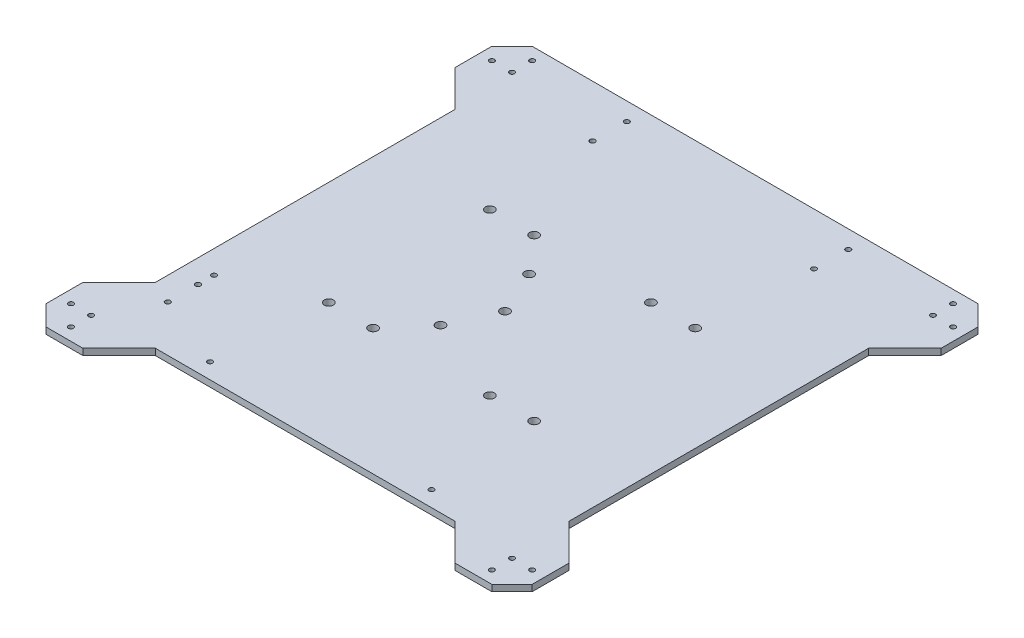
from build123d import *

# Parameters (mm, degrees)
BOSS_EXTRUDE1_DEPTH      = 3.175
SKETCH2_R                = 1.5
SKETCH2_R_2              = 2.25
CUT_EXTRUDE1_DEPTH       = 171.795800958
M3X0_5_TAPPED_HOLE1_D    = 2.5
SKETCH5_R                = 1.25
CUT_EXTRUDE2_DEPTH       = 171.795800958
SKETCH6_R                = 1.25
CUT_EXTRUDE3_DEPTH       = 10
M4_CLEARANCE_HOLE1_D     = 4.5
M4_CLEARANCE_HOLE1_DEPTH = 10
M4_CLEARANCE_HOLE1_TIP   = 1.351936393
CUT_EXTRUDE4_DEPTH       = 10
M3X0_5_TAPPED_HOLE2_D    = 2.5


with BuildPart() as part:
    # Sketch1 → Boss-Extrude1 (new body)
    with BuildSketch(Plane(origin=(0, 0, 0), x_dir=(1, 0, 0), z_dir=(0, 1, 0))):
        Polygon((-110.75, 120.75), (110.75, 120.75), (120.75, 110.75), (120.75, -110.75), (110.75, -120.75), (-110.75, -120.75), (-120.75, -110.75), (-120.75, 110.75), align=None)
    extrude(amount=BOSS_EXTRUDE1_DEPTH)

    # Sketch2 → Cut-Extrude1 (cut, through all)
    with BuildSketch(Plane(origin=(0, 3.175, 0), x_dir=(1, 0, 0), z_dir=(0, 1, 0))):
        with Locations((-51, -40)):
            Circle(SKETCH2_R)
        with Locations((-29, -40)):
            Circle(SKETCH2_R_2)
        with Locations((-51, 40)):
            Circle(SKETCH2_R)
        with Locations((-29, 40)):
            Circle(SKETCH2_R_2)
        with Locations((29, 40)):
            Circle(SKETCH2_R_2)
        with Locations((51, 40)):
            Circle(SKETCH2_R_2)
        with Locations((29, -40)):
            Circle(SKETCH2_R_2)
        with Locations((51, -40)):
            Circle(SKETCH2_R_2)
        with Locations((-3.5, 0)):
            Circle(SKETCH2_R_2)
        with Locations((-13.5, 22)):
            Circle(SKETCH2_R_2)
        with Locations((-13.5, -22)):
            Circle(SKETCH2_R_2)
    extrude(amount=-CUT_EXTRUDE1_DEPTH, mode=Mode.SUBTRACT)

    # M3x0.5 Tapped Hole1 (through all)
    with Locations(Plane(origin=(0, 3.175, 0), x_dir=(-1, 0, 0), z_dir=(0, 1, 0))):
        with Locations((114.55, -104.55), (104.55, -114.55), (-104.55, -114.55), (-114.55, -104.55), (-114.55, 104.55), (-104.55, 114.55), (104.55, 114.55), (114.55, 104.55), (-104.55, 104.55), (-104.55, -104.55), (104.55, -104.55), (104.55, 104.55)):
            Hole(M3X0_5_TAPPED_HOLE1_D / 2)

    # Sketch5 → Cut-Extrude2 (cut, through all)
    with BuildSketch(Plane(origin=(0, 3.175, 0), x_dir=(1, 0, 0), z_dir=(0, 1, 0))):
        with Locations((-55, 95)):
            Circle(SKETCH5_R)
        with Locations((55, 95)):
            Circle(SKETCH5_R)
        with Locations((-55, -95)):
            Circle(SKETCH5_R)
        with Locations((55, -95)):
            Circle(SKETCH5_R)
    extrude(amount=-CUT_EXTRUDE2_DEPTH, mode=Mode.SUBTRACT)

    # Sketch6 → Cut-Extrude3 (cut)
    with BuildSketch(Plane(origin=(0, 3.175, 0), x_dir=(1, 0, 0), z_dir=(0, 1, 0))):
        with Locations((-91.25, -64.75)):
            Circle(SKETCH6_R)
        with Locations((-91.25, -56.75)):
            Circle(SKETCH6_R)
        with Locations((-91.25, -79.75)):
            Circle(SKETCH6_R)
    extrude(amount=-CUT_EXTRUDE3_DEPTH, mode=Mode.SUBTRACT)

    # M4 Clearance Hole1
    with Locations(Plane(origin=(0, 3.175, 0), x_dir=(-1, 0, 0), z_dir=(0, 1, 0))):
        with Locations((51, -40), (51, 40)):
            Hole(M4_CLEARANCE_HOLE1_D / 2, depth=M4_CLEARANCE_HOLE1_DEPTH)
            with Locations((0, 0, -(M4_CLEARANCE_HOLE1_DEPTH + M4_CLEARANCE_HOLE1_TIP / 2))):  # 118° drill point
                Cone(0, M4_CLEARANCE_HOLE1_D / 2, M4_CLEARANCE_HOLE1_TIP, mode=Mode.SUBTRACT)

    # Sketch9 → Cut-Extrude4 (cut)
    with BuildSketch(Plane(origin=(0, 3.175, 0), x_dir=(1, 0, 0), z_dir=(0, 1, 0))):
        Polygon((-120.75, 92.465728753), (-102.75, 74.465728753), (-102.75, -74.465728753), (-120.75, -92.465728753), align=None)
        Polygon((120.75, 92.465728753), (102.75, 74.465728753), (102.75, -74.465728753), (120.75, -92.465728753), align=None)
        Polygon((-92.465728753, -120.75), (-74.465728753, -102.75), (74.465728753, -102.75), (92.465728753, -120.75), align=None)
    extrude(amount=-CUT_EXTRUDE4_DEPTH, mode=Mode.SUBTRACT)

    # M3x0.5 Tapped Hole2 (through all)
    with Locations(Plane(origin=(0, 3.175, 0), x_dir=(-1, 0, 0), z_dir=(0, 1, 0))):
        with Locations((-55.188488938, -111.84444349), (54.811511062, -111.84444349)):
            Hole(M3X0_5_TAPPED_HOLE2_D / 2)


solid = part.part
